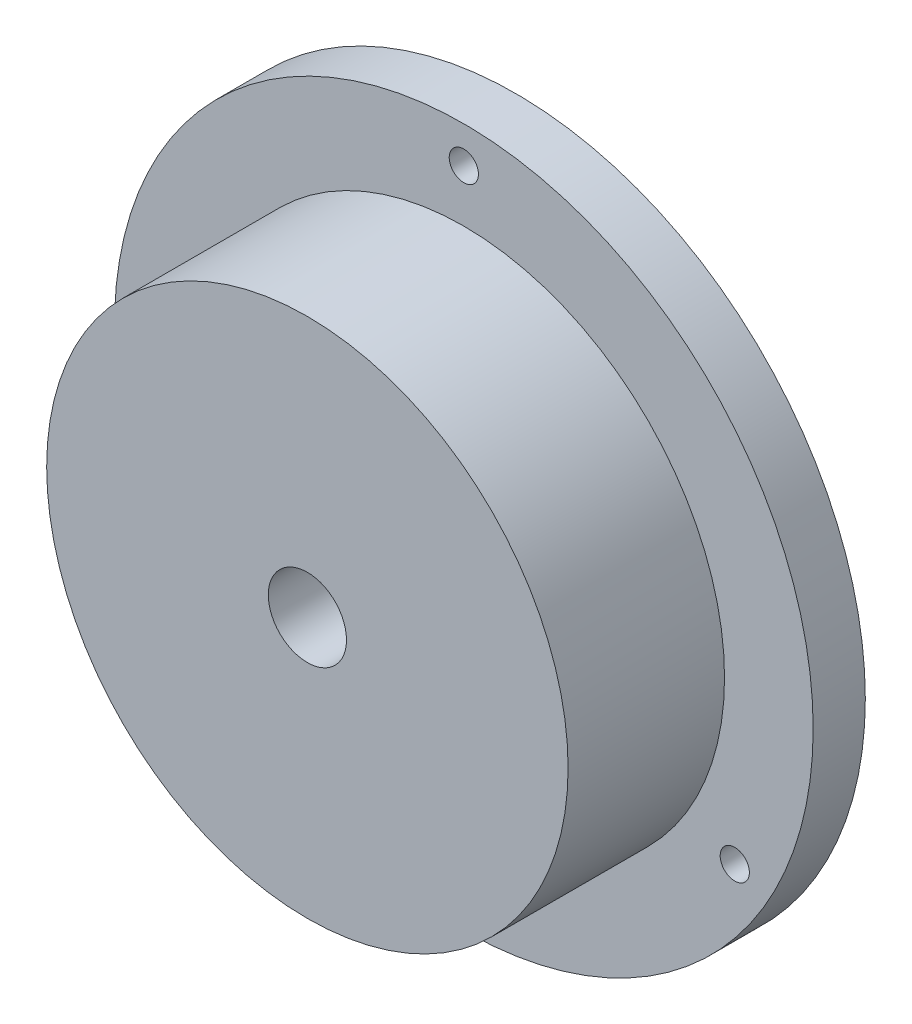
from build123d import *

# Parameters (mm, degrees)
SKETCH1_R                      = 21.2725
BOSS_EXTRUDE1_DEPTH            = 3.175
SKETCH2_R                      = 15.875
BOSS_EXTRUDE2_DEPTH            = 9.525
F_3_16_0_1875_DIAMETER_HOLE1_D = 4.7625
F_2_56_TAPPED_HOLE3_D          = 1.778
CIRPATTERN1_COUNT              = 3
F_8_32_TAPPED_HOLE1_D          = 3.4544
F_8_32_TAPPED_HOLE1_DEPTH      = 21.2715
F_8_32_TAPPED_HOLE1_TIP        = 1.037806461
SKETCH14_R                     = 7.9375
CUT_EXTRUDE1_DEPTH             = 3.8862


with BuildPart() as part:
    # Sketch1 → Boss-Extrude1 (new body)
    with BuildSketch(Plane.XY):
        Circle(SKETCH1_R)
    extrude(amount=BOSS_EXTRUDE1_DEPTH)

    # Sketch2 → Boss-Extrude2 (add)
    with BuildSketch(Plane.XY.offset(3.175)):
        Circle(SKETCH2_R)
    extrude(amount=BOSS_EXTRUDE2_DEPTH)

    # 3/16 (0.1875) Diameter Hole1 (through all)
    with Locations(Plane.XY.offset(12.7)):
        with Locations((0, 0)):
            Hole(F_3_16_0_1875_DIAMETER_HOLE1_D / 2)

    # #2-56 Tapped Hole3 (through all)
    with Locations(Plane.XY.offset(3.175)):
        with Locations((0, 19.05)):
            f_2_56_tapped_hole3 = Hole(F_2_56_TAPPED_HOLE3_D / 2)

    # CirPattern1: #2-56 Tapped Hole3 ×3 about axis
    cirpattern1_axis = Axis((0, 0, 3.175), (0, 0, 1))
    for i in range(1, CIRPATTERN1_COUNT):
        add(f_2_56_tapped_hole3.rotate(cirpattern1_axis, i * 360 / CIRPATTERN1_COUNT), mode=Mode.SUBTRACT)

    # #8-32 Tapped Hole1
    with Locations(Plane.XZ.offset(21.2725)):
        with Locations((0, 7.9248)):
            Hole(F_8_32_TAPPED_HOLE1_D / 2, depth=F_8_32_TAPPED_HOLE1_DEPTH)
            with Locations((0, 0, -(F_8_32_TAPPED_HOLE1_DEPTH + F_8_32_TAPPED_HOLE1_TIP / 2))):  # 118° drill point
                Cone(0, F_8_32_TAPPED_HOLE1_D / 2, F_8_32_TAPPED_HOLE1_TIP, mode=Mode.SUBTRACT)

    # Sketch14 → Cut-Extrude1 (cut)
    with BuildSketch(Plane(origin=(0, 0, 0), x_dir=(-1, 0, 0), z_dir=(0, 0, -1))):
        Circle(SKETCH14_R)
    extrude(amount=-CUT_EXTRUDE1_DEPTH, mode=Mode.SUBTRACT)


solid = part.part
